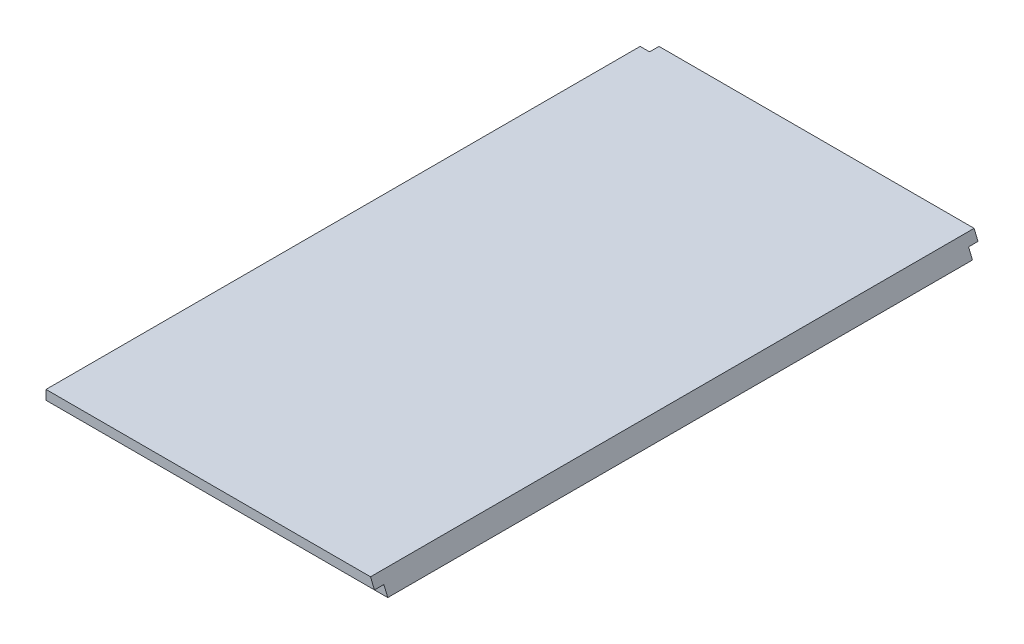
from build123d import *

# Parameters (mm, degrees)
BOSS_EXTRUDE1_DEPTH = 406.4
SKETCH2_W           = 223.774
SKETCH2_H           = 6.35
SKETCH2_W_2         = 217.424
CUT_EXTRUDE1_DEPTH  = 6.35
SKETCH3_W           = 6.35
SKETCH3_H           = 6.35
CUT_EXTRUDE2_DEPTH  = 465.108880626


with BuildPart() as part:
    # Sketch1 → Boss-Extrude1 (new body)
    with BuildSketch(Plane.XY):
        Polygon((0, 0), (0, 12.7), (218.513487758, 12.7), (223.774, 0), align=None)
    extrude(amount=BOSS_EXTRUDE1_DEPTH)

    # Sketch2 → Cut-Extrude1 (cut)
    with BuildSketch(Plane.XZ):
        with Locations((111.887, 403.225)):
            Rectangle(SKETCH2_W, SKETCH2_H)
        with Locations((115.062, 3.175)):
            Rectangle(SKETCH2_W_2, SKETCH2_H)
    extrude(amount=-CUT_EXTRUDE1_DEPTH, mode=Mode.SUBTRACT)

    # Sketch3 → Cut-Extrude2 (cut, through all)
    with BuildSketch(Plane.XZ):
        with Locations((3.175, 3.175)):
            Rectangle(SKETCH3_W, SKETCH3_H)
    extrude(amount=-CUT_EXTRUDE2_DEPTH, mode=Mode.SUBTRACT)


solid = part.part
